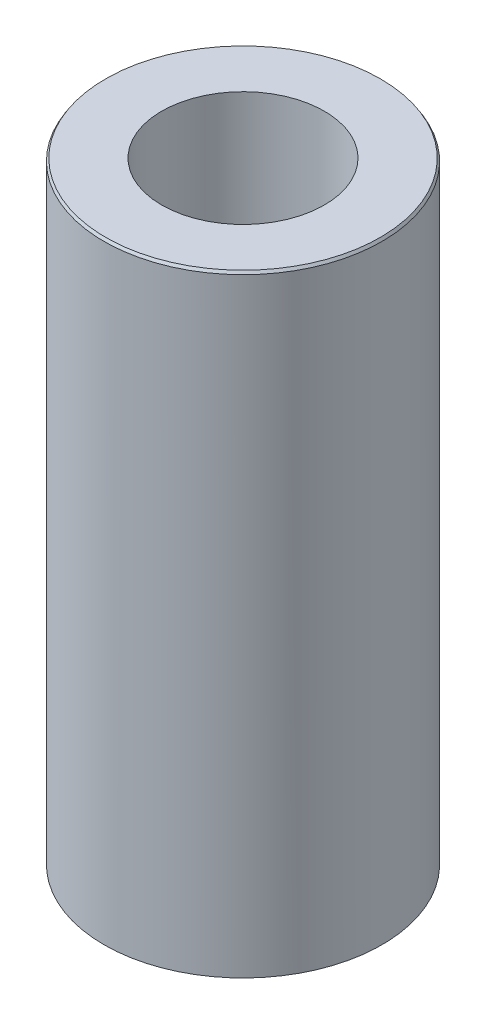
from build123d import *
from OCP.BRepFilletAPI import BRepFilletAPI_MakeChamfer

# Parameters (mm, degrees)
SKETCH1_R           = 12.5
BOSS_EXTRUDE1_DEPTH = 55.156029957
SKETCH2_R           = 7.314663148
CUT_EXTRUDE1_DEPTH  = 58.919665405
CHAMFER1_SIZE       = 0.241608916
CHAMFER1_SIZE2      = 0.150368299


with BuildPart() as part:
    # Sketch1 → Boss-Extrude1 (new body)
    with BuildSketch(Plane(origin=(0, 0, 0), x_dir=(1, 0, 0), z_dir=(0, 1, 0))):
        Circle(SKETCH1_R)
    extrude(amount=BOSS_EXTRUDE1_DEPTH)

    # Sketch2 → Cut-Extrude1 (cut, through all)
    with BuildSketch(Plane(origin=(0, 0, 0), x_dir=(1, 0, 0), z_dir=(0, 1, 0))):
        Circle(SKETCH2_R)
    extrude(amount=CUT_EXTRUDE1_DEPTH, mode=Mode.SUBTRACT)

    # Chamfer1: one chamfer whose edges measure the first distance from different faces: ONE call of the kernel's chamfer builder (chamfer() names one face for all edges)
    chamfer1_edges_1 = [part.edges().sort_by_distance(p)[0] for p in [
        (-12.5, 55.156029957, 0),
    ]]
    chamfer1_side_1 = [part.faces().sort_by_distance(p)[0] for p in [
        (-12.5, 27.578014979, 0),
    ]]
    chamfer1_edges_2 = [part.edges().sort_by_distance(p)[0] for p in [
        (-12.5, 0, 0),
    ]]
    chamfer1_side_2 = [part.faces().sort_by_distance(p)[0] for p in [
        (-12.146446609, 0, 0),
    ]]
    chamfer1 = BRepFilletAPI_MakeChamfer(part.part.solid().wrapped)
    for e in chamfer1_edges_1:
        chamfer1.Add(CHAMFER1_SIZE, CHAMFER1_SIZE2, e.wrapped, chamfer1_side_1[0].wrapped)  # the first distance lies on this face
    for e in chamfer1_edges_2:
        chamfer1.Add(CHAMFER1_SIZE, CHAMFER1_SIZE2, e.wrapped, chamfer1_side_2[0].wrapped)  # the first distance lies on this face
    add(Compound.cast(chamfer1.Shape()), mode=Mode.REPLACE)


solid = part.part
